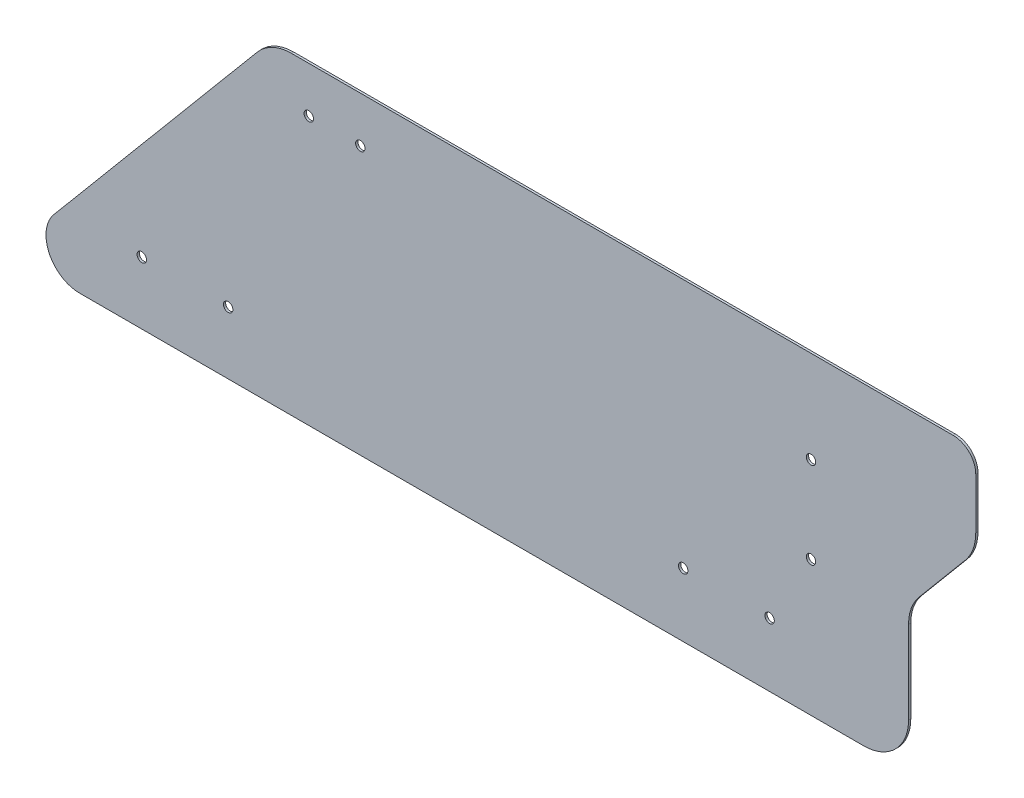
from build123d import *

# Parameters (mm, degrees)
BASE_FLANGE1_DEPTH                 = 1
F_4_2_START                        = -1
F_4_2_4_2_DIAMETER_HOLE1_OUTLINE_R = 2.1
F_4_2_4_2_DIAMETER_HOLE1_DEPTH     = 1


# Read off the part's stored shape, not the designer's step: Ø4.2 (4.2) Diameter Hole1
# Sheet-metal steps are written as plain solids
with BuildPart() as part:
    # Sketch1 → Base-Flange1 (new body)
    with BuildSketch(Plane.XY):
        with BuildLine():
            Line((-120.688391142, 62.855752194), (-211.490666647, -45.358185855))
            ThreePointArc((-211.490666647, -45.358185855), (-213.594616806, -61.339273926), (-200, -70))
            Line((-200, -70), (150, -70))
            ThreePointArc((150, -70), (164.142135624, -64.142135624), (170, -50))
            Line((170, -50), (170, -13.032012463))
            ThreePointArc((170, -13.032012463), (171.206147584, -6.191609597), (174.679111138, -0.176260269))
            Line((174.679111138, -0.176260269), (195.320888862, 24.423652492))
            ThreePointArc((195.320888862, 24.423652492), (198.793852416, 30.439001819), (200, 37.279404685))
            Line((200, 37.279404685), (200, 60))
            ThreePointArc((200, 60), (197.071067812, 67.071067812), (190, 70))
            Line((190, 70), (-105.36750228, 70))
            ThreePointArc((-105.36750228, 70), (-113.819867515, 68.126155741), (-120.688391142, 62.855752194))
        make_face()
    extrude(amount=-BASE_FLANGE1_DEPTH)

    # Ø4.2 (4.2) Diameter Hole1 outline → Ø4.2 (4.2) Diameter Hole1 (cut)
    with BuildSketch(Plane.XY.offset(F_4_2_START)):
        with Locations((107.976556815, -41.6)):
            Circle(F_4_2_4_2_DIAMETER_HOLE1_OUTLINE_R)
        with Locations((69.42162602, -41.6)):
            Circle(F_4_2_4_2_DIAMETER_HOLE1_OUTLINE_R)
        with Locations((-133.690845807, -42.192339034)):
            Circle(F_4_2_4_2_DIAMETER_HOLE1_OUTLINE_R)
        with Locations((-172.245776602, -42.192339034)):
            Circle(F_4_2_4_2_DIAMETER_HOLE1_OUTLINE_R)
        with Locations((-74.698274088, 49.596767959)):
            Circle(F_4_2_4_2_DIAMETER_HOLE1_OUTLINE_R)
        with Locations((126.46596136, -9.64433534)):
            Circle(F_4_2_4_2_DIAMETER_HOLE1_OUTLINE_R)
        with Locations((-97.693405311, 49.596767959)):
            Circle(F_4_2_4_2_DIAMETER_HOLE1_OUTLINE_R)
        with Locations((126.46596136, 28.910595455)):
            Circle(F_4_2_4_2_DIAMETER_HOLE1_OUTLINE_R)
    extrude(amount=F_4_2_4_2_DIAMETER_HOLE1_DEPTH, mode=Mode.SUBTRACT)


solid = part.part
